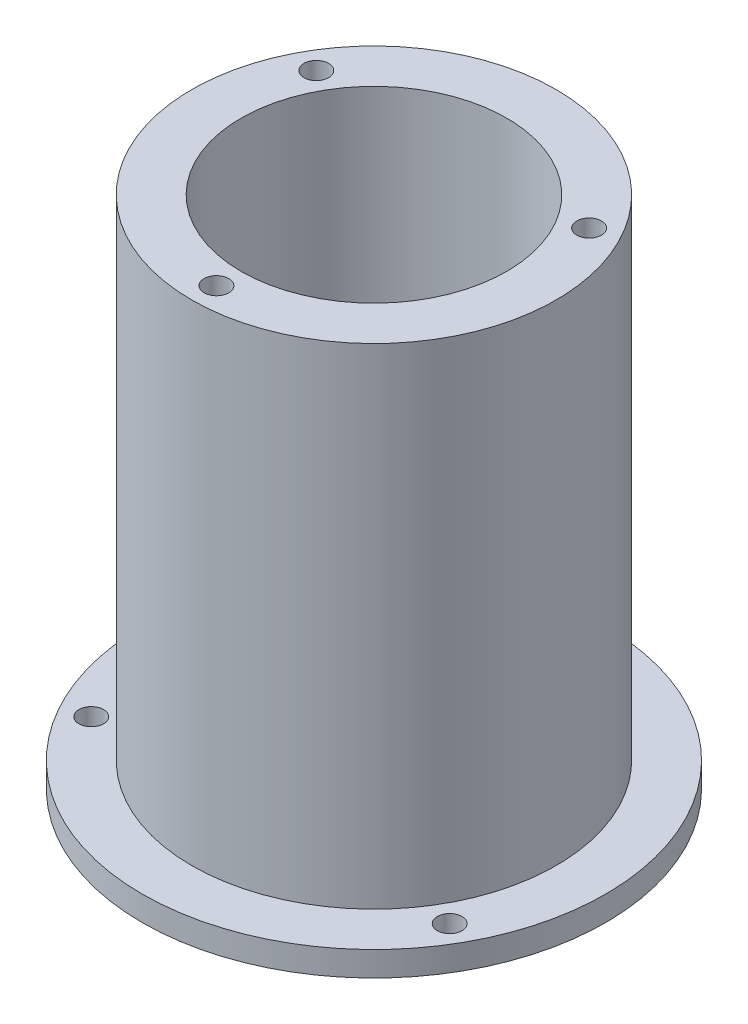
from build123d import *

# Parameters (mm, degrees)
SKETCH1_R           = 37.5
SKETCH1_R_2         = 21.5
BOSS_EXTRUDE1_DEPTH = 4
SKETCH2_R           = 29.5
SKETCH2_R_2         = 21.5
BOSS_EXTRUDE2_DEPTH = 79.3
SKETCH3_R           = 2
CUT_EXTRUDE1_DEPTH  = 96.399109011
CIRPATTERN1_COUNT   = 3
SKETCH4_R           = 2
CUT_EXTRUDE2_DEPTH  = 6
CIRPATTERN2_COUNT   = 3


with BuildPart() as part:
    # Sketch1 → Boss-Extrude1 (new body)
    with BuildSketch(Plane(origin=(0, 0, 0), x_dir=(1, 0, 0), z_dir=(0, 1, 0))):
        Circle(SKETCH1_R)
        Circle(SKETCH1_R_2, mode=Mode.SUBTRACT)
    extrude(amount=BOSS_EXTRUDE1_DEPTH)

    # Sketch2 → Boss-Extrude2 (add)
    with BuildSketch(Plane(origin=(0, 4, 0), x_dir=(1, 0, 0), z_dir=(0, 1, 0))):
        Circle(SKETCH2_R)
        Circle(SKETCH2_R_2, mode=Mode.SUBTRACT)
    extrude(amount=BOSS_EXTRUDE2_DEPTH)

    # Sketch3 → Cut-Extrude1 (cut, through all)
    with BuildSketch(Plane(origin=(0, 4, 0), x_dir=(1, 0, 0), z_dir=(0, 1, 0))):
        with Locations((0, 33.5)):
            Circle(SKETCH3_R)
    cut_extrude1 = extrude(amount=-CUT_EXTRUDE1_DEPTH, mode=Mode.SUBTRACT)

    # CirPattern1: Cut-Extrude1 ×3 about axis
    cirpattern1_axis = Axis((0, 4, 0), (0, 1, 0))
    for i in range(1, CIRPATTERN1_COUNT):
        add(cut_extrude1.rotate(cirpattern1_axis, i * 360 / CIRPATTERN1_COUNT), mode=Mode.SUBTRACT)

    # Sketch4 → Cut-Extrude2 (cut)
    with BuildSketch(Plane(origin=(0, 83.3, 0), x_dir=(1, 0, 0), z_dir=(0, 1, 0))):
        with Locations((-22.083647797, 12.75)):
            Circle(SKETCH4_R)
    cut_extrude2 = extrude(amount=-CUT_EXTRUDE2_DEPTH, mode=Mode.SUBTRACT)

    # CirPattern2: Cut-Extrude2 ×3 about axis
    cirpattern2_axis = Axis((0, 83.3, 0), (0, 1, 0))
    for i in range(1, CIRPATTERN2_COUNT):
        add(cut_extrude2.rotate(cirpattern2_axis, i * 360 / CIRPATTERN2_COUNT), mode=Mode.SUBTRACT)


solid = part.part
